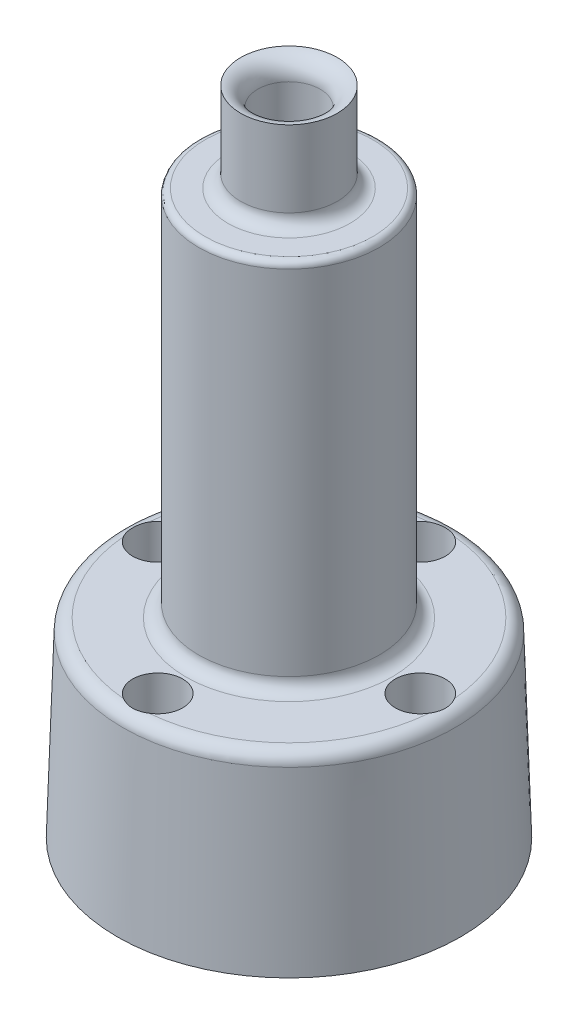
from build123d import *

# Parameters (mm, degrees)
LARGE_RADII_R                 = 0.508
SMALL_OD_RADII_R              = 0.254
F_42_0_0935_LOX_INLET_D       = 2.1
F_42_0_0935_LOX_INLET_DEPTH   = 8.89
F_42_0_0935_LOX_INLET_TIP     = 0.6309036499789383
F_1_8_0_125_LOX_LEAD_IN_D     = 2.5
F_1_8_0_125_LOX_LEAD_IN_DEPTH = 17.145
F_1_8_0_125_LOX_LEAD_IN_TIP   = 0.7510757737844503
CIRPATTERN1_COUNT             = 4
FILLET1_R                     = 0.762


with BuildPart() as part:
    # Sketch2 → Revolve1 (revolve)
    with BuildSketch(Plane.XY, mode=Mode.PRIVATE) as revolve1_sk:
        Polygon((0, 0), (6.8580000000000005, 0), (6.619876412211779, 7.619999999999999), (3.606800000000001, 7.619999999999999), (3.6067999999999993, 22.478999999999996), (1.9304000000000003, 22.478999999999996), (1.9304000000000003, 26.034999999999997), (-2e-17, 26.034999999999997), align=None)
    revolve(revolve1_sk.sketch.rotate(Axis((0, 0, 0), (0, 1, 0)), 90), axis=Axis((0, 0, 0), (0, 1, 0)))

    # Large Radii
    large_radii_edges = [part.edges().sort_by_distance(p)[0] for p in [
        (-1.31e-15, 22.478999999999996, 1.9304000000000003),
        (-8.4e-16, 7.619999999999999, 3.606800000000001),
        (-1.55e-15, 7.619999999999999, 6.619876412211779),
    ]]
    fillet(large_radii_edges, radius=LARGE_RADII_R)

    # Small OD Radii
    small_od_radii_edges = [part.edges().sort_by_distance(p)[0] for p in [
        (-8.4e-16, 22.478999999999996, 3.6067999999999993),
    ]]
    fillet(small_od_radii_edges, radius=SMALL_OD_RADII_R)

    # #42 (0.0935) LOX Inlet
    with Locations(Plane.XZ):
        with Locations((0, 0)):
            Hole(F_42_0_0935_LOX_INLET_D / 2, depth=F_42_0_0935_LOX_INLET_DEPTH)
            with Locations((0, 0, -(F_42_0_0935_LOX_INLET_DEPTH + F_42_0_0935_LOX_INLET_TIP / 2))):  # 118° drill point
                Cone(0, F_42_0_0935_LOX_INLET_D / 2, F_42_0_0935_LOX_INLET_TIP, mode=Mode.SUBTRACT)

    # 1/8 (0.125) LOX Lead-in
    with Locations(Plane(origin=(0, 26.034999999999997, 0), x_dir=(1, 0, 0), z_dir=(0, 1, 0))):
        with Locations((0, 0)):
            Hole(F_1_8_0_125_LOX_LEAD_IN_D / 2, depth=F_1_8_0_125_LOX_LEAD_IN_DEPTH)
            with Locations((0, 0, -(F_1_8_0_125_LOX_LEAD_IN_DEPTH + F_1_8_0_125_LOX_LEAD_IN_TIP / 2))):  # 118° drill point
                Cone(0, F_1_8_0_125_LOX_LEAD_IN_D / 2, F_1_8_0_125_LOX_LEAD_IN_TIP, mode=Mode.SUBTRACT)

    # Sketch16 → Ø2.0 (2) Diameter Hole2 (revolve, cut)
    with BuildSketch(Plane(origin=(5.245100000000001, 7.619999999999999, 0), x_dir=(0, 0, 1), z_dir=(1, 0, 0))):
        Polygon((0, 0), (-1.33e-15, 5.426860619027559), (0.9999999999999986, 4.825999999999999), (0.9999999999999888, -1.43e-15), align=None)
    f_2_0_2_diameter_hole2 = revolve(axis=Axis((5.245100000000001, 13.96999999999999, 0), (0, -1, 0)), mode=Mode.SUBTRACT)

    # Sketch11 → Fuel Hole (revolve, cut)
    with BuildSketch(Plane.XY, mode=Mode.PRIVATE) as fuel_hole_sk:
        Polygon((2.2860000000000382, -0.5303301028604733), (5.587999999999999, 2.77166989713949), (5.322834948569763, 3.0368349485697266), (2.0208349485698007, -0.26516505143023533), align=None)
    fuel_hole = revolve(fuel_hole_sk.sketch.rotate(Axis((5.322834948569763, 3.0368349485697266, 0), (-0.7071067811865476, -0.7071067811865476, 0)), 214.199192908), axis=Axis((5.322834948569763, 3.0368349485697266, 0), (-0.7071067811865476, -0.7071067811865476, 0)), mode=Mode.SUBTRACT)

    # Sketch12 → Fuel Spot Drill (revolve, cut)
    with BuildSketch(Plane.XY, mode=Mode.PRIVATE) as fuel_spot_drill_sk:
        Polygon((2.7467848160919206, 0.46078481609188404), (2.0828000000000366, 0.6386990113502337), (1.2409009886498032, -0.20320000000000016), (1.66185049432492, -0.6241495056751171), align=None)
    fuel_spot_drill = revolve(fuel_spot_drill_sk.sketch.rotate(Axis((2.7467848160919206, 0.46078481609188404, 0), (-0.7071067811865475, -0.7071067811865477, 0)), 34.199192908), axis=Axis((2.7467848160919206, 0.46078481609188404, 0), (-0.7071067811865475, -0.7071067811865477, 0)), mode=Mode.SUBTRACT)

    # CirPattern1: Ø2.0 (2) Diameter Hole2, Fuel Hole, Fuel Spot Drill ×4 about axis
    cirpattern1_axis = Axis((0, 0, 9.16e-15), (0, 1, 0))
    add([f_2_0_2_diameter_hole2.rotate(cirpattern1_axis, i * 360 / CIRPATTERN1_COUNT) for i in range(1, CIRPATTERN1_COUNT)], mode=Mode.SUBTRACT)
    add([fuel_hole.rotate(cirpattern1_axis, i * 360 / CIRPATTERN1_COUNT) for i in range(1, CIRPATTERN1_COUNT)], mode=Mode.SUBTRACT)
    add([fuel_spot_drill.rotate(cirpattern1_axis, i * 360 / CIRPATTERN1_COUNT) for i in range(1, CIRPATTERN1_COUNT)], mode=Mode.SUBTRACT)

    # Fillet1
    # the kernel refuses this fillet: 0.762 mm, written as the material it takes off along each edge
    with BuildSketch(Plane(origin=(0, 26.034999999999997, 0), x_dir=(-1, 0, 0), z_dir=(0, 0, 1))) as fillet1_piece_1:
        with BuildLine():
            CenterArc((2.012, 0.75761826799517), FILLET1_R, 180, 83.85260130416106)
            Line((1.25, 0.75761826799517), (1.23476, 0.75761826799517))
            Line((1.23476, 0.75761826799517), (1.23476, 0))
            Line((1.23476, 0), (1.25, -0.01523999999999859))
            ThreePointArc((1.25, -0.01523999999999859), (1.5902000000000003, -0.01523999999999859), (1.9287680000000003, -0.01515236535990283))
            Line((1.9287680000000003, -0.01515236535990283), (1.9304000000000003, 0))
        make_face()
    revolve(axis=Axis((0, 26.034999999999997, 0), (0, -1, 0)), mode=Mode.SUBTRACT)


solid = part.part
